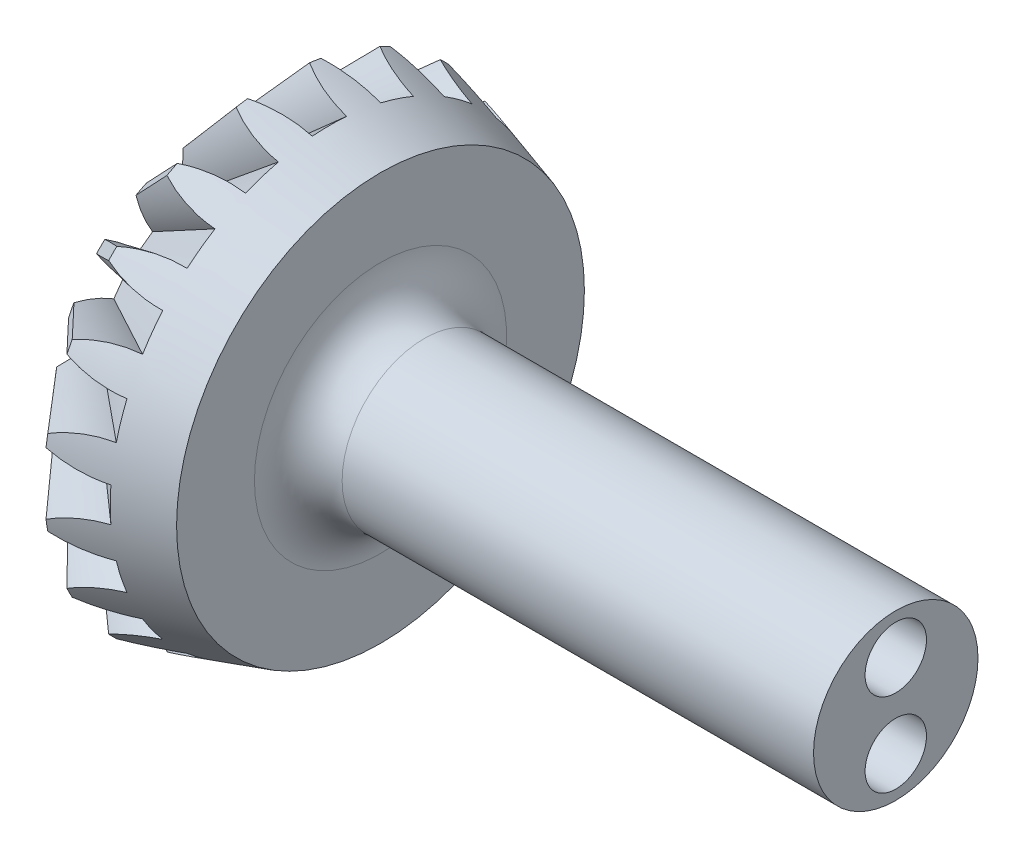
from build123d import *

# Parameters (mm, degrees)
CIRPATTERN1_COUNT   = 20
SKETCH_1_R          = 8
SKETCH_1_R_2        = 3
CUT_EXTRUDE_1_DEPTH = 7
SKETCH_2_R          = 3.75
EXTRUDE_1_DEPTH     = 23.5
FILLET_2_R          = 2
SKETCH_3_R          = 1.4
CUT_EXTRUDE_2_DEPTH = 5


with BuildPart() as part:
    # Sketch1 → Revolve1 (revolve)
    with BuildSketch(Plane.XY):
        Polygon((0, 3), (14.6, 3), (14.6, 8), (7.6, 8), (7.6, 9.3), (2.951475221, 10.7), (0, 7.303119958), align=None)
    revolve(axis=Axis((0, 0, 0), (1, 0, 0)))

    # Sketch6 for Cut-Loft1 → Cut-Loft1 section 0
    with BuildSketch(Plane(origin=(5.27573761, 0, 0), x_dir=(0, 0, -1), z_dir=(1, 0, 0))):
        with BuildLine():
            Line((-5.214961125, 16.05), (5.214961125, 16.05))
            # circular arc as an exact rational Bezier (weights 1, cos(half-angle), 1)
            Bezier((5.214961125, 16.05), (1.131031442, 14.371117063), (0.784590957, 9.969173337), weights=[1, 0.851943225, 1])
            Bezier((0.784590957, 9.969173337), (0, 10.030921985), (-0.784590957, 9.969173337), weights=[1, 0.996917334, 1])
            Bezier((-0.784590957, 9.969173337), (-1.131031442, 14.371117063), (-5.214961125, 16.05), weights=[1, 0.851943225, 1])
        make_face()
    # Sketch5 for Cut-Loft1 → Cut-Loft1 section 1
    with BuildSketch(Plane.ZY):
        with BuildLine():
            Line((-0.419756162, 5.333507735), (0.419756162, 5.333507735))
            Bezier((0.419756162, 5.333507735), (0.6664631, 8.468216601), (3.30648184, 10.176304724), weights=[1, 0.896497279, 1])
            Bezier((3.30648184, 10.176304724), (0, 11.250645799), (-3.30648184, 10.176304724), weights=[1, 0.951056516, 1])
            Bezier((-3.30648184, 10.176304724), (-0.6664631, 8.468216601), (-0.419756162, 5.333507735), weights=[1, 0.896497279, 1])
        make_face()
    cut_loft1 = loft(mode=Mode.SUBTRACT)

    # CirPattern1: Cut-Loft1 ×20 about axis
    cirpattern1_axis = Axis((0, 0, 0), (-1, 0, 0))
    for i in range(1, CIRPATTERN1_COUNT):
        add(cut_loft1.rotate(cirpattern1_axis, i * 360 / CIRPATTERN1_COUNT), mode=Mode.SUBTRACT)

    # 草图1 → 切除-拉伸1 (cut)
    with BuildSketch(Plane(origin=(14.6, 0, 0), x_dir=(0, 0, -1), z_dir=(1, 0, 0))):
        Circle(SKETCH_1_R)
        Circle(SKETCH_1_R_2, mode=Mode.SUBTRACT)
    extrude(amount=-CUT_EXTRUDE_1_DEPTH, mode=Mode.SUBTRACT)

    # 草图2 → 凸台-拉伸1 (add)
    with BuildSketch(Plane(origin=(7.6, 0, 0), x_dir=(0, 0, -1), z_dir=(1, 0, 0))):
        Circle(SKETCH_2_R)
    extrude(amount=EXTRUDE_1_DEPTH)

    # 圆角2
    fillet_2_edges = [part.edges().sort_by_distance(p)[0] for p in [
        (7.6, 0, 3.75),
    ]]
    fillet(fillet_2_edges, radius=FILLET_2_R)

    # 草图3 → 切除-拉伸2 (cut)
    with BuildSketch(Plane(origin=(31.1, 0, 0), x_dir=(0, 0, -1), z_dir=(1, 0, 0))):
        with Locations((0, 1.9)):
            Circle(SKETCH_3_R)
        with Locations((0, -1.9)):
            Circle(SKETCH_3_R)
    extrude(amount=-CUT_EXTRUDE_2_DEPTH, mode=Mode.SUBTRACT)


solid = part.part
